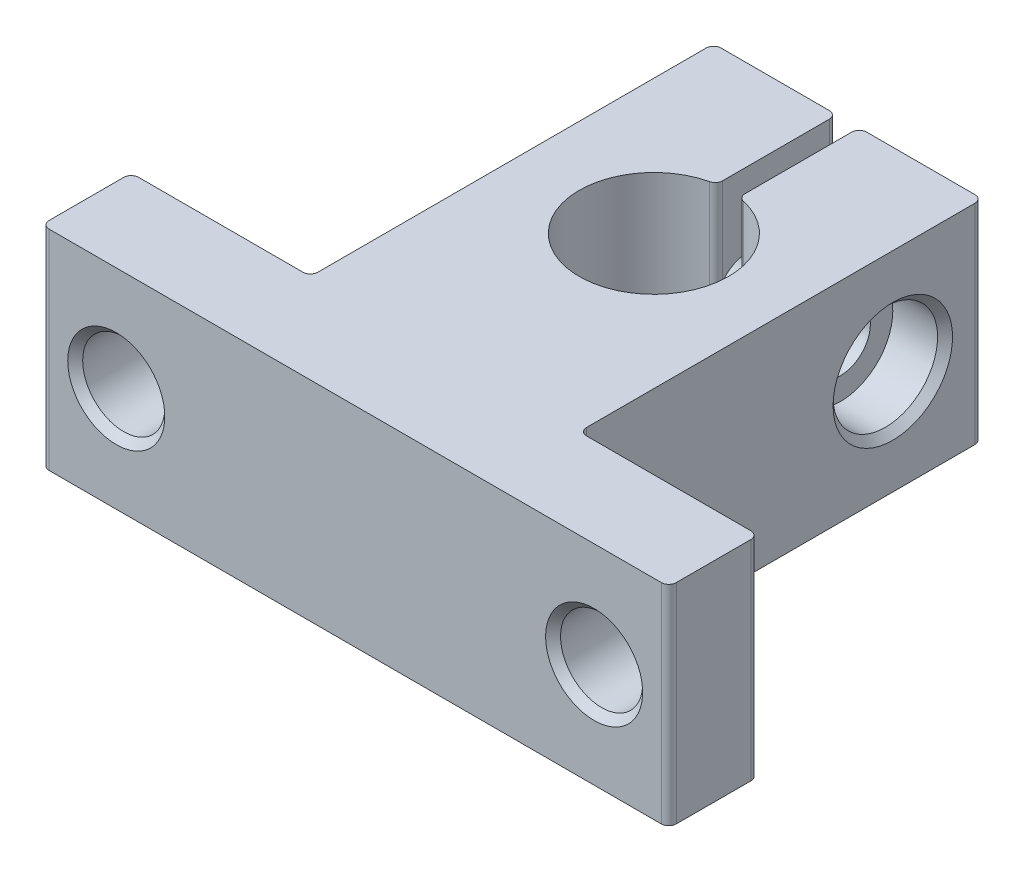
from build123d import *

# Parameters (mm, degrees)
BOSS_EXTRUDE1_DEPTH = 14
SKETCH2_R           = 2.75
CUT_EXTRUDE1_DEPTH  = 14
SKETCH3_R           = 2
CUT_EXTRUDE2_DEPTH  = 45.676615807
SKETCH4_R           = 3.5
CUT_EXTRUDE3_DEPTH  = 3.5
FILLET1_R           = 0.5
CHAMFER1_SIZE       = 0.5


with BuildPart() as part:
    # Sketch1 → Boss-Extrude1 (new body)
    with BuildSketch(Plane(origin=(0, 0, 0), x_dir=(1, 0, 0), z_dir=(0, 1, 0))):
        with BuildLine():
            Line((-21, 3), (-21, -3))
            Line((-21, -3), (21, -3))
            Line((21, -3), (21, 3))
            Line((21, 3), (9, 3))
            Line((9, 3), (9, 30))
            Line((9, 30), (0.75, 30))
            Line((0.75, 30), (0.75, 21.943429983))
            ThreePointArc((0.75, 21.943429983), (0, 12), (-0.75, 21.943429983))
            Line((-0.75, 21.943429983), (-0.75, 30))
            Line((-0.75, 30), (-9, 30))
            Line((-9, 30), (-9, 3))
            Line((-9, 3), (-21, 3))
        make_face()
    extrude(amount=BOSS_EXTRUDE1_DEPTH)

    # Sketch2 → Cut-Extrude1 (cut)
    with BuildSketch(Plane(origin=(0, 0, -3), x_dir=(-1, 0, 0), z_dir=(0, 0, -1))):
        with BuildLine():
            Line((-18.75, 7), (-16, 7))
            Line((-16, 7), (-13.25, 7))
            ThreePointArc((-13.25, 7), (-16, 9.75), (-18.75, 7))
        make_face()
        with BuildLine():
            Line((-13.25, 7), (-16, 7))
            Line((-16, 7), (-18.75, 7))
            ThreePointArc((-18.75, 7), (-16, 4.25), (-13.25, 7))
        make_face()
        with Locations((16, 7)):
            Circle(SKETCH2_R)
    extrude(amount=-CUT_EXTRUDE1_DEPTH, mode=Mode.SUBTRACT)

    # Sketch3 → Cut-Extrude2 (cut, through all)
    with BuildSketch(Plane(origin=(9, 0, 0), x_dir=(0, 0, -1), z_dir=(1, 0, 0))):
        with Locations((24, 7)):
            Circle(SKETCH3_R)
    extrude(amount=-CUT_EXTRUDE2_DEPTH, mode=Mode.SUBTRACT)

    # Sketch4 → Cut-Extrude3 (cut)
    with BuildSketch(Plane(origin=(9, 0, 0), x_dir=(0, 0, -1), z_dir=(1, 0, 0))):
        with Locations((24, 7)):
            Circle(SKETCH4_R)
    extrude(amount=-CUT_EXTRUDE3_DEPTH, mode=Mode.SUBTRACT)

    # Fillet1
    # the kernel refuses this fillet: 0.5 mm, written as the material it adds along each edge
    with BuildSketch(Plane(origin=(9, 0, -3), x_dir=(1, 0, 0), z_dir=(0, 1, 0)), Plane(origin=(-9, 0, -3), x_dir=(0, 0, -1), z_dir=(0, 1, 0))) as fillet1_piece_1:
        with BuildLine():
            CenterArc((FILLET1_R, FILLET1_R), FILLET1_R, 180, 90)
            Line((0, FILLET1_R), (0, 0))
            Line((0, 0), (FILLET1_R, 0))
        make_face()
    extrude(amount=14)
    # the kernel refuses this fillet: 0.5 mm, written as the material it takes off along each edge
    with BuildSketch(Plane(origin=(0.75, -1.031603345, -21.943429983), x_dir=(0.9820189181944738, 0, 0.18878253178765073), z_dir=(0, 1, 0))) as fillet1_2_piece_1:
        with BuildLine():
            CenterArc((0.413109983, 0.499612866), FILLET1_R, 190.881742673, 76.863441213)
            Line((-0.077899477, 0.4052216), (0, 0))
            ThreePointArc((0, 0), (0.196719039, 0.003871337), (0.393438079, 0))
        make_face()
    extrude(amount=16.06320669, mode=Mode.SUBTRACT)
    with BuildSketch(Plane(origin=(0.75, -1.25, -30), x_dir=(0, 0, 1), z_dir=(0, 1, 0))) as fillet1_2_piece_2:
        with BuildLine():
            CenterArc((FILLET1_R, FILLET1_R), FILLET1_R, 180, 90)
            Line((0, FILLET1_R), (0, 0))
            Line((0, 0), (FILLET1_R, 0))
        make_face()
    extrude(amount=16.5, mode=Mode.SUBTRACT)
    with BuildSketch(Plane(origin=(9, -1.25, -30), x_dir=(0, 0, 1), z_dir=(0, 1, 0)), Plane(origin=(-9, -1.25, -30), x_dir=(1, 0, 0), z_dir=(0, 1, 0)), Plane(origin=(-0.75, -1.25, -30), x_dir=(0, 0, 1), z_dir=(0, 1, 0)), Plane(origin=(21, -1.25, 3), x_dir=(-1, 0, 0), z_dir=(0, 1, 0)), Plane(origin=(21, -1.25, -3), x_dir=(0, 0, 1), z_dir=(0, 1, 0)), Plane(origin=(-21, -1.25, -3), x_dir=(1, 0, 0), z_dir=(0, 1, 0)), Plane(origin=(-21, -1.25, 3), x_dir=(0, 0, -1), z_dir=(0, 1, 0))) as fillet1_2_piece_3:
        with BuildLine():
            CenterArc((FILLET1_R, -FILLET1_R), FILLET1_R, 90, 90)
            Line((0, -FILLET1_R), (0, 0))
            Line((0, 0), (FILLET1_R, 0))
        make_face()
    extrude(amount=16.5, mode=Mode.SUBTRACT)
    with BuildSketch(Plane(origin=(-0.75, -1.031603345, -21.943429983), x_dir=(0, 0, -1), z_dir=(0, 1, 0))) as fillet1_2_piece_4:
        with BuildLine():
            CenterArc((0.412641338, 0.5), FILLET1_R, 193.136558787, 76.863441213)
            ThreePointArc((-0.074274237, 0.386363636), (-0.033335392, 0.193912659), (0, 0))
            Line((0, 0), (0.412641338, 0))
        make_face()
    extrude(amount=16.06320669, mode=Mode.SUBTRACT)

    # Chamfer1
    chamfer1_edges = [part.edges().sort_by_distance(p)[0] for p in [
        (-13.25, 7, 3),
        (-13.25, 7, -3),
        (13.25, 7, 3),
        (13.25, 7, -3),
        (-9, 7, -22),
        (9, 7, -20.5),
    ]]
    chamfer(chamfer1_edges, length=CHAMFER1_SIZE)


solid = part.part
